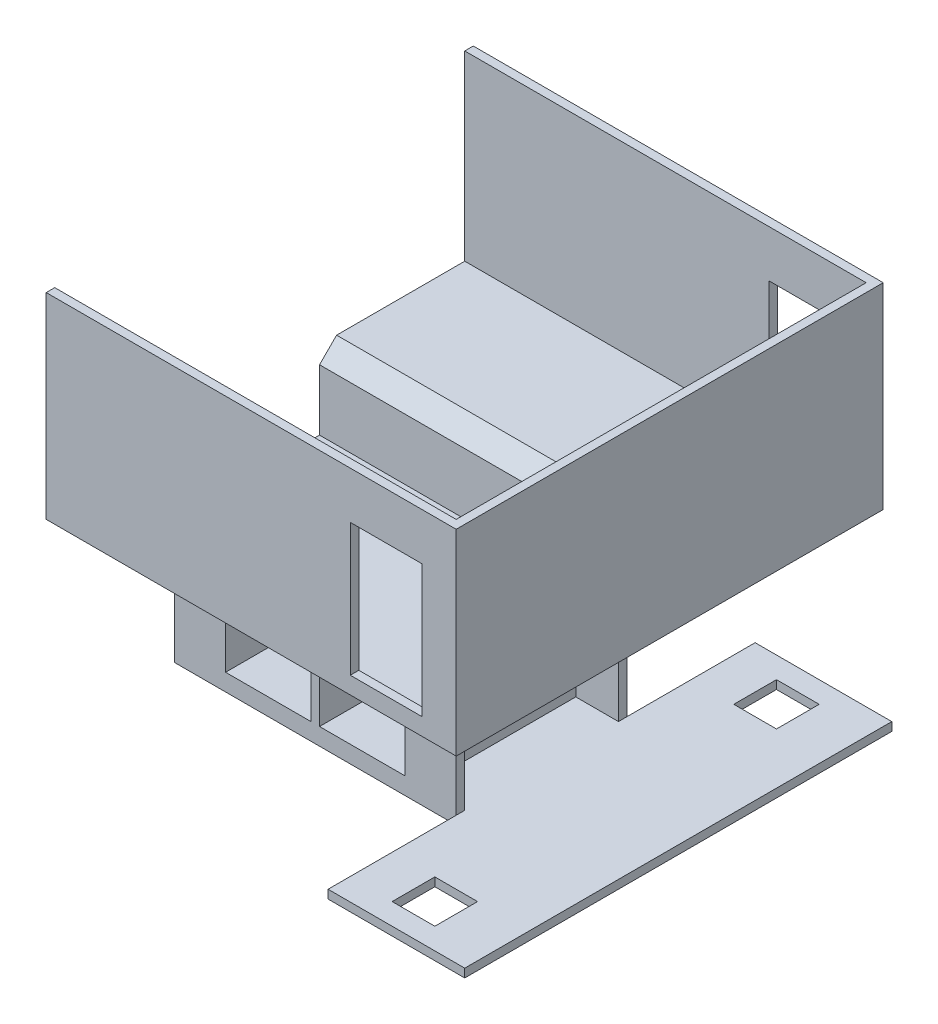
from build123d import *

# Parameters (mm, degrees)
SKETCH1_W           = 45
SKETCH1_H           = 50
BOSS_EXTRUDE1_DEPTH = 45
SKETCH2_W           = 22
SKETCH2_H           = 22
CUT_EXTRUDE2_DEPTH  = 15
SKETCH3_W           = 10
SKETCH3_H           = 12
CUT_EXTRUDE3_DEPTH  = 70
SKETCH4_W           = 10
SKETCH4_H           = 12
CUT_EXTRUDE4_DEPTH  = 70
SKETCH5_W           = 22
SKETCH5_H           = 22
CUT_EXTRUDE5_DEPTH  = 15
SKETCH6_W           = 15
SKETCH6_H           = 21.883389701
CUT_EXTRUDE6_DEPTH  = 15
SKETCH7_W           = 5
SKETCH7_H           = 22
CUT_EXTRUDE7_DEPTH  = 15
SKETCH8_W           = 48
SKETCH8_H           = 21.319032177
CUT_EXTRUDE8_DEPTH  = 44
SKETCH9_W           = 15
SKETCH9_H           = 0.116610299
CUT_EXTRUDE9_DEPTH  = 44
SKETCH10_W          = 18
SKETCH10_H          = 9.135333164
CUT_EXTRUDE10_DEPTH = 44
SKETCH11_W          = 12
SKETCH11_H          = 45
CUT_EXTRUDE11_DEPTH = 50
SKETCH12_W          = 15
SKETCH12_H          = 22
CUT_EXTRUDE12_DEPTH = 10
SKETCH14_W          = 18
SKETCH14_H          = 13.545634659
CUT_EXTRUDE17_DEPTH = 5
BOSS_EXTRUDE2_DEPTH = 1
SKETCH18_W          = 16
SKETCH18_H          = 50
BOSS_EXTRUDE3_DEPTH = 1
SKETCH19_W          = 5
SKETCH19_H          = 5
CUT_EXTRUDE18_DEPTH = 1
SKETCH21_W          = 50
SKETCH21_H          = 23
BOSS_EXTRUDE4_DEPTH = 15
SKETCH22_W          = 8.4
SKETCH22_H          = 15.5
CUT_EXTRUDE21_DEPTH = 90
SKETCH24_W          = 48
SKETCH24_H          = 21.319032177
CUT_EXTRUDE22_DEPTH = 14
SKETCH25_W          = 28
SKETCH25_H          = 2
BOSS_EXTRUDE5_DEPTH = 9.135334
CHAMFER1_SIZE       = 2
SKETCH26_W          = 5
SKETCH26_H          = 2
BOSS_EXTRUDE7_DEPTH = 5
SKETCH27_R          = 1
CUT_EXTRUDE23_DEPTH = 5


with BuildPart() as part:
    # Sketch1 → Boss-Extrude1 (new body)
    with BuildSketch(Plane(origin=(0, 0, 0), x_dir=(1, 0, 0), z_dir=(0, 1, 0))):
        with Locations((-1.111578991, 5.036171713)):
            Rectangle(SKETCH1_W, SKETCH1_H)
    extrude(amount=BOSS_EXTRUDE1_DEPTH)

    # Sketch2 → Cut-Extrude2 (cut)
    with BuildSketch(Plane.XY.offset(19.963828287)):
        with Locations((-12.611578991, 11)):
            Rectangle(SKETCH2_W, SKETCH2_H)
    extrude(amount=-CUT_EXTRUDE2_DEPTH, mode=Mode.SUBTRACT)

    # Sketch3 → Cut-Extrude3 (cut)
    with BuildSketch(Plane.XY.offset(4.963828287)):
        with Locations((-12.611578991, 8)):
            Rectangle(SKETCH3_W, SKETCH3_H)
    extrude(amount=-CUT_EXTRUDE3_DEPTH, mode=Mode.SUBTRACT)

    # Sketch4 → Cut-Extrude4 (cut)
    with BuildSketch(Plane(origin=(0, 0, -30.036171713), x_dir=(-1, 0, 0), z_dir=(0, 0, -1))):
        with Locations((1.611578991, 8)):
            Rectangle(SKETCH4_W, SKETCH4_H)
    extrude(amount=-CUT_EXTRUDE4_DEPTH, mode=Mode.SUBTRACT)

    # Sketch5 → Cut-Extrude5 (cut)
    with BuildSketch(Plane(origin=(0, 0, -30.036171713), x_dir=(-1, 0, 0), z_dir=(0, 0, -1))):
        with Locations((1.611578991, 11)):
            Rectangle(SKETCH5_W, SKETCH5_H)
    extrude(amount=-CUT_EXTRUDE5_DEPTH, mode=Mode.SUBTRACT)

    # Sketch6 → Cut-Extrude6 (cut)
    with BuildSketch(Plane.ZY.offset(23.611578991)):
        with Locations((-22.536171713, 10.941694851)):
            Rectangle(SKETCH6_W, SKETCH6_H)
    extrude(amount=-CUT_EXTRUDE6_DEPTH, mode=Mode.SUBTRACT)

    # Sketch7 → Cut-Extrude7 (cut)
    with BuildSketch(Plane.XY.offset(19.963828287)):
        with Locations((0.888421009, 11)):
            Rectangle(SKETCH7_W, SKETCH7_H)
    extrude(amount=-CUT_EXTRUDE7_DEPTH, mode=Mode.SUBTRACT)

    # Sketch8 → Cut-Extrude8 (cut)
    with BuildSketch(Plane.ZY.offset(23.611578991)):
        with Locations((-5.036171713, 34.340483912)):
            Rectangle(SKETCH8_W, SKETCH8_H)
    extrude(amount=-CUT_EXTRUDE8_DEPTH, mode=Mode.SUBTRACT)

    # Sketch9 → Cut-Extrude9 (cut)
    with BuildSketch(Plane(origin=(-12.611578991, 0, 0), x_dir=(0, 0, -1), z_dir=(1, 0, 0))):
        with Locations((22.536171713, 21.94169485)):
            Rectangle(SKETCH9_W, SKETCH9_H)
    extrude(amount=-CUT_EXTRUDE9_DEPTH, mode=Mode.SUBTRACT)

    # Sketch10 → Cut-Extrude10 (cut)
    with BuildSketch(Plane.ZY.offset(23.611578991)):
        with Locations((-5.036171713, 19.113301241)):
            Rectangle(SKETCH10_W, SKETCH10_H)
    extrude(amount=-CUT_EXTRUDE10_DEPTH, mode=Mode.SUBTRACT)

    # Sketch11 → Cut-Extrude11 (cut)
    with BuildSketch(Plane(origin=(0, 0, -30.036171713), x_dir=(-1, 0, 0), z_dir=(0, 0, -1))):
        with Locations((-15.388421009, 22.5)):
            Rectangle(SKETCH11_W, SKETCH11_H)
    extrude(amount=-CUT_EXTRUDE11_DEPTH, mode=Mode.SUBTRACT)

    # Sketch12 → Cut-Extrude12 (cut)
    with BuildSketch(Plane(origin=(9.388421009, 0, 0), x_dir=(0, 0, -1), z_dir=(1, 0, 0))):
        with Locations((-12.463828287, 11)):
            Rectangle(SKETCH12_W, SKETCH12_H)
    extrude(amount=-CUT_EXTRUDE12_DEPTH, mode=Mode.SUBTRACT)

    # Sketch14 → Cut-Extrude17 (cut)
    with BuildSketch(Plane(origin=(9.388421009, 0, 0), x_dir=(0, 0, -1), z_dir=(1, 0, 0))):
        with Locations((5.036171713, 7.77281733)):
            Rectangle(SKETCH14_W, SKETCH14_H)
    extrude(amount=-CUT_EXTRUDE17_DEPTH, mode=Mode.SUBTRACT)

    # Sketch16 → Boss-Extrude2 (add)
    with BuildSketch(Plane(origin=(0, 0, 0), x_dir=(-1, 0, 0), z_dir=(0, -1, 0))):
        Polygon((-9.388421009, -4.963828287), (-9.388421009, 30.036171713), (-25.285959903, 30.036171713), (-25.285959903, -1.106934493), (-25.285959903, -19.963828287), (-9.388421009, -19.963828287), align=None)
    extrude(amount=-BOSS_EXTRUDE2_DEPTH)

    # Sketch18 → Boss-Extrude3 (add)
    with BuildSketch(Plane(origin=(0, 1, 0), x_dir=(1, 0, 0), z_dir=(0, 1, 0))):
        with Locations((17.388421009, 5.036171713)):
            Rectangle(SKETCH18_W, SKETCH18_H)
    extrude(amount=-BOSS_EXTRUDE3_DEPTH)

    # Sketch19 → Cut-Extrude18 (cut)
    with BuildSketch(Plane(origin=(0, 1, 0), x_dir=(1, 0, 0), z_dir=(0, 1, 0))):
        with Locations((16.888421009, -14.963828287)):
            Rectangle(SKETCH19_W, SKETCH19_H)
        with Locations((16.888421009, 25.036171713)):
            Rectangle(SKETCH19_W, SKETCH19_H)
    extrude(amount=-CUT_EXTRUDE18_DEPTH, mode=Mode.SUBTRACT)

    # Sketch21 → Boss-Extrude4 (add)
    with BuildSketch(Plane(origin=(9.388421009, 0, 0), x_dir=(0, 0, -1), z_dir=(1, 0, 0))):
        with Locations((5.036171713, 33.5)):
            Rectangle(SKETCH21_W, SKETCH21_H)
    extrude(amount=BOSS_EXTRUDE4_DEPTH)

    # Sketch22 → Cut-Extrude21 (cut)
    with BuildSketch(Plane.XY.offset(19.963828287)):
        with Locations((16.188421009, 31.75)):
            Rectangle(SKETCH22_W, SKETCH22_H)
    extrude(amount=-CUT_EXTRUDE21_DEPTH, mode=Mode.SUBTRACT)

    # Sketch24 → Cut-Extrude22 (cut)
    with BuildSketch(Plane.ZY.offset(-9.388421009)):
        with Locations((-5.036171713, 34.340483912)):
            Rectangle(SKETCH24_W, SKETCH24_H)
    extrude(amount=-CUT_EXTRUDE22_DEPTH, mode=Mode.SUBTRACT)

    # Sketch25 → Boss-Extrude5 (add)
    with BuildSketch(Plane(origin=(0, 14.545634659, 0), x_dir=(1, 0, 0), z_dir=(0, 1, 0))):
        with Locations((-9.611578991, 13.036171713)):
            Rectangle(SKETCH25_W, SKETCH25_H)
        with Locations((-9.611578991, -2.963828287)):
            Rectangle(SKETCH25_W, SKETCH25_H)
    extrude(amount=BOSS_EXTRUDE5_DEPTH)

    # Chamfer1
    chamfer1_edges = [part.edges().sort_by_distance(p)[0] for p in [
        (-9.611578991, 23.680968659, 1.963828287),
        (-9.611578991, 23.680968659, -12.036171713),
    ]]
    chamfer(chamfer1_edges, length=CHAMFER1_SIZE - 0.0001)  # a hair under: the kernel refuses the full size

    # Sketch26 → Boss-Extrude7 (add)
    with BuildSketch(Plane(origin=(24.388421009, 0, 0), x_dir=(0, 0, -1), z_dir=(1, 0, 0))):
        with Locations((21.036171713, 38)):
            Rectangle(SKETCH26_W, SKETCH26_H)
        with Locations((-10.963828287, 38)):
            Rectangle(SKETCH26_W, SKETCH26_H)
    extrude(amount=-BOSS_EXTRUDE7_DEPTH)

    # Sketch27 → Cut-Extrude23 (cut)
    with BuildSketch(Plane(origin=(0, 39, 0), x_dir=(1, 0, 0), z_dir=(0, 1, 0))):
        with Locations(Location((21.138421009, -10.963828287, 0), (0, 0, 270))):
            Circle(SKETCH27_R)
        with Locations(Location((21.138421009, 21.036171713, 0), (0, 0, 270))):
            Circle(SKETCH27_R)
    extrude(amount=-CUT_EXTRUDE23_DEPTH, mode=Mode.SUBTRACT)


solid = part.part
